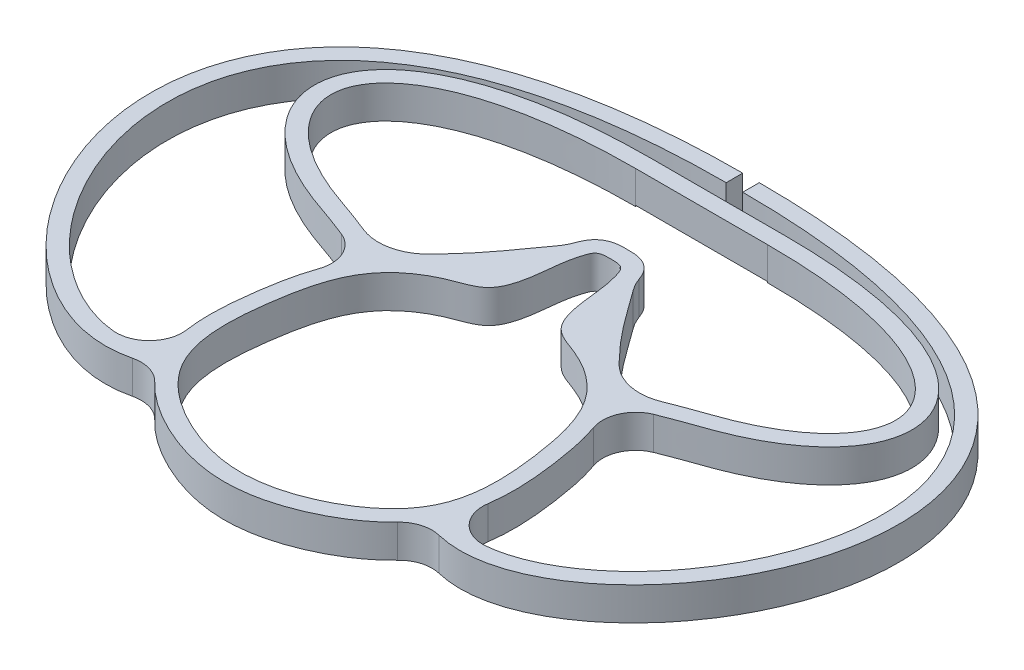
from build123d import *
from build123d.topology import SkipClean

# Parameters (mm, degrees)
BOSS_EXTRUDE1_DEPTH = 10
BOSS_EXTRUDE2_DEPTH = 10
BOSS_EXTRUDE3_REACH = 171.643
SKETCH5_W           = 5
SKETCH5_H           = 9.675639368
BOSS_EXTRUDE4_DEPTH = 10
CUT_EXTRUDE1_DEPTH  = 10
FILLET1_R           = 10
FILLET2_R           = 15
FILLET3_R           = 15


# Read off the part's stored shape, not the designer's step: Boss-Extrude1, Cut-Extrude1
with BuildPart() as part:
    # Boss-Extrude1 outline → Boss-Extrude1 (new body)
    with BuildSketch(Plane(origin=(0, 0, 0), x_dir=(1, 0, 0), z_dir=(0, 1, 0))):
        with BuildLine():
            add(Edge.make_bspline(
                [(0, 67), (-0.227277761, 67), (-0.681833283, 67.001666463), (-1.53188424, 66.987419462), (-2.512616186, 66.920390168), (-3.659808632, 66.741423554), (-4.988078912, 66.345813864), (-6.461410265, 65.591532761), (-7.855664764, 64.320134683), (-8.674867778, 63.107594724), (-9.208577304, 62.038948076), (-9.565323902, 61.116231979), (-9.81270012, 60.379002225), (-10.109494449, 59.430262188), (-10.431305892, 58.253962276), (-10.746251776, 56.878966311), (-11.001988254, 55.538552687), (-11.278954519, 53.801167078), (-11.533903834, 51.724013951), (-11.779395274, 49.374961626), (-12.037895469, 47.15146515), (-12.37325539, 45.013087546), (-12.836023726, 42.949483136), (-13.43538801, 41.198480929), (-14.003306657, 40.162683233), (-14.421319862, 39.640462503), (-14.785845689, 39.289383208), (-15.662463961, 38.701677793), (-17.417991117, 37.934908047), (-19.71677033, 37.105178592), (-22.397054658, 36.023724998), (-24.923710241, 34.773040568), (-27.361549766, 33.353237603), (-30.447251781, 31.236918919), (-33.968327967, 28.188031587), (-37.531580238, 23.840893393), (-40.196367538, 19.062950436), (-42.777966406, 12.392766722), (-44.256778564, 5.449271056), (-45.276374738, -1.416843531), (-45.88344846, -6.702537457), (-46.188923174, -12.061007753), (-46.075354509, -17.440185452), (-45.397688101, -22.789778918), (-44.007346965, -28.029159469), (-41.697102792, -33.095574637), (-38.474325789, -37.633129013), (-34.621503503, -41.580890086), (-28.836339185, -46.140112515), (-20.775488621, -50.574915101), (-10.663531249, -54.093742691), (1.1e-08, -55.453128652), (10.663531287, -54.093742702), (20.775488621, -50.574915094), (28.836339175, -46.140112511), (34.621503494, -41.580890085), (38.474325783, -37.633129015), (41.69710279, -33.09557464), (44.007346967, -28.029159472), (45.397688104, -22.78977892), (46.075354512, -17.440185452), (46.188923176, -12.061007753), (45.883448461, -6.702537456), (45.276374738, -1.416843531), (44.256778563, 5.449271057), (42.777966405, 12.392766722), (40.196367538, 19.062950436), (37.531580238, 23.840893392), (33.968327967, 28.188031587), (30.447251781, 31.236918919), (27.361549766, 33.353237603), (24.923710241, 34.773040568), (22.397054658, 36.023724998), (19.71677033, 37.105178592), (17.417991117, 37.934908047), (15.662463961, 38.701677793), (14.785845689, 39.289383208), (14.421319862, 39.640462503), (14.003306657, 40.162683233), (13.43538801, 41.198480929), (12.836023726, 42.949483136), (12.37325539, 45.013087546), (12.037895469, 47.15146515), (11.779395274, 49.374961626), (11.533903834, 51.724013951), (11.278954519, 53.801167078), (11.001988254, 55.538552687), (10.746251776, 56.878966311), (10.431305892, 58.253962276), (10.109494449, 59.430262188), (9.81270012, 60.379002225), (9.565323902, 61.116231979), (9.208577304, 62.038948076), (8.674867778, 63.107594724), (7.855664764, 64.320134683), (6.461410265, 65.591532761), (4.988078912, 66.345813864), (3.659808632, 66.741423554), (2.512616186, 66.920390168), (1.53188424, 66.987419462), (0.681833283, 67.001666463), (0.227277761, 67), (0, 67)],
                knots=[0, 0, 0, 0, 0.001953125, 0.00390625, 0.005859375, 0.0078125, 0.009765625, 0.01171875, 0.013671875, 0.015625, 0.017578125, 0.01953125, 0.021484375, 0.0234375, 0.02734375, 0.03125, 0.03515625, 0.0390625, 0.046875, 0.0546875, 0.0625, 0.0703125, 0.078125, 0.0859375, 0.09375, 0.09765625, 0.1015625, 0.109375, 0.1171875, 0.125, 0.1328125, 0.140625, 0.1484375, 0.15625, 0.171875, 0.1875, 0.203125, 0.21875, 0.25, 0.265625, 0.28125, 0.296875, 0.3125, 0.328125, 0.34375, 0.359375, 0.375, 0.390625, 0.40625, 0.4375, 0.46875, 0.5, 0.53125, 0.5625, 0.59375, 0.609375, 0.625, 0.640625, 0.65625, 0.671875, 0.6875, 0.703125, 0.71875, 0.734375, 0.75, 0.78125, 0.796875, 0.8125, 0.828125, 0.84375, 0.8515625, 0.859375, 0.8671875, 0.875, 0.8828125, 0.890625, 0.8984375, 0.90234375, 0.90625, 0.9140625, 0.921875, 0.9296875, 0.9375, 0.9453125, 0.953125, 0.9609375, 0.96484375, 0.96875, 0.97265625, 0.9765625, 0.978515625, 0.98046875, 0.982421875, 0.984375, 0.986328125, 0.98828125, 0.990234375, 0.9921875, 0.994140625, 0.99609375, 0.998046875, 1, 1, 1, 1], degree=3))
        make_face()
        with BuildLine():
            add(Edge.make_bspline(
                [(0, 62), (-1.449319465, 62), (-3.858982521, 62.04949065), (-6.738088954, 54.674450921), (-6.398410727, 46.424048099), (-10.00931101, 34.796181627), (-21.899395638, 31.626752299), (-35.797702461, 21.622188592), (-41.072037529, -2.03881706), (-42.664534833, -30.677270085), (-20.455240468, -46.503909991), (2.22e-07, -51.476412309), (20.455240774, -46.503909745), (42.664534842, -30.677270089), (41.072037527, -2.038817059), (35.797702462, 21.622188592), (21.899395638, 31.626752299), (10.00931101, 34.796181627), (6.398410727, 46.424048099), (6.738088954, 54.674450921), (3.858982521, 62.04949065), (1.449319465, 62), (0, 62)],
                knots=[0, 0, 0, 0, 0.01260166, 0.020951733, 0.070611873, 0.099127767, 0.128336455, 0.183200023, 0.259103987, 0.357412488, 0.439784745, 0.500000002, 0.560215255, 0.642587512, 0.740896013, 0.816799977, 0.871663545, 0.900872233, 0.929388127, 0.979048267, 0.98739834, 1, 1, 1, 1], degree=3))
        make_face(mode=Mode.SUBTRACT)
    extrude(amount=BOSS_EXTRUDE1_DEPTH)

    # Sketch4 → Boss-Extrude2 (add)
    with SkipClean():  # the faces are left unmerged after this step: merging them gives an invalid solid
        with BuildSketch(Plane(origin=(0, 0, 0), x_dir=(1, 0, 0), z_dir=(0, 1, 0))):
            with BuildLine():
                Line((36.001435144, 21.510151116), (32.989848884, 25.501435144))
                add(Edge.make_bspline(
                    [(32.989848884, 25.501435144), (33.872885271, 26.167722041), (35.70627525, 27.442947556), (39.412291226, 29.656207311), (44.146726789, 31.935811391), (49.778788636, 34.120248533), (55.204617591, 36.003618773), (60.222668304, 37.804441191), (66.261128759, 40.406907607), (72.735637535, 44.029228931), (78.689747015, 48.769362933), (82.814006884, 53.702907128), (85.126039639, 58.613963179), (85.736019918, 63.354621027), (84.727818137, 67.976997128), (81.951398145, 72.574921409), (77.174218712, 77.030053571), (70.266405808, 81.113970819), (62.685058655, 84.025405736), (55.50694373, 85.96352112), (49.562823706, 87.199703158), (43.053997804, 88.197120813), (37.156071694, 88.812170602), (32.150826498, 89.164473975), (28.253879576, 89.356359617), (24.883393499, 89.453928271), (22.120518947, 89.493360579), (20.703917009, 89.5), (20, 89.5)],
                    knots=[0, 0, 0, 0, 0.015625, 0.03125, 0.0625, 0.09375, 0.125, 0.15625, 0.1875, 0.25, 0.3125, 0.375, 0.4375, 0.5, 0.5625, 0.625, 0.6875, 0.75, 0.8125, 0.84375, 0.875, 0.90625, 0.9375, 0.953125, 0.96875, 0.984375, 0.9921875, 1, 1, 1, 1], degree=3))
                Line((20, 89.5), (20, 94.5))
                add(Edge.make_bspline(
                    [(36.001435144, 21.510151116), (36.787353247, 22.103158314), (38.41215106, 23.23341812), (41.75318908, 25.230241561), (46.109318801, 27.331559417), (51.473302563, 29.415314403), (56.822722549, 31.272745471), (62.033332845, 33.140687066), (68.490270454, 35.920857119), (75.481392114, 39.826546751), (82.146371183, 45.111108904), (87.014356274, 50.893766256), (89.978752698, 57.093818062), (90.840895008, 63.561777201), (89.428293025, 69.948343891), (85.802397561, 75.862447574), (80.107155766, 81.125203271), (72.383848138, 85.667804388), (64.233189607, 88.787969959), (56.657749977, 90.832221781), (50.441682078, 92.124204995), (43.684113773, 93.159188874), (37.595989232, 93.793709294), (32.447651138, 94.156026664), (28.44762402, 94.352944671), (24.994641313, 94.452873973), (22.167505261, 94.49321488), (20.719652627, 94.5), (20, 94.5)],
                    knots=[0, 0, 0, 0, 0.015625, 0.03125, 0.0625, 0.09375, 0.125, 0.15625, 0.1875, 0.25, 0.3125, 0.375, 0.4375, 0.5, 0.5625, 0.625, 0.6875, 0.75, 0.8125, 0.84375, 0.875, 0.90625, 0.9375, 0.953125, 0.96875, 0.984375, 0.9921875, 1, 1, 1, 1], degree=3))
            make_face()
            with BuildLine():
                Line((38.495197904, -33.392577358), (40.892577358, -29.004802096))
                add(Edge.make_bspline(
                    [(40.892577358, -29.004802096), (41.312625944, -29.234306979), (42.171418914, -29.676482267), (43.871583625, -30.44643491), (46.006564059, -31.223557149), (48.572376388, -31.870163588), (52.00609967, -32.374234855), (56.325810275, -32.365824), (63.290306726, -31.105045204), (72.031798663, -27.396461734), (82.047486904, -20.227411651), (91.092686595, -10.784912996), (101.249050978, 4.150738003), (107.653654804, 21.566800636), (108.674992071, 39.368395292), (106.385287015, 52.420187702), (100.663597402, 64.743387458), (91.059797932, 75.959707892), (79.376006686, 84.026780706), (67.560232156, 89.451479145), (57.405420795, 92.935683077), (45.901005212, 95.766311436), (35.144967454, 97.523129539), (25.811490261, 98.53351264), (18.443264592, 99.085415563), (11.981918075, 99.366847206), (6.637273541, 99.480783681), (3.871322005, 99.5), (2.5, 99.5)],
                    knots=[0, 0, 0, 0, 0.0078125, 0.015625, 0.03125, 0.046875, 0.0625, 0.09375, 0.125, 0.1875, 0.25, 0.3125, 0.375, 0.5, 0.5625, 0.625, 0.6875, 0.75, 0.8125, 0.84375, 0.875, 0.90625, 0.9375, 0.953125, 0.96875, 0.984375, 0.9921875, 1, 1, 1, 1], degree=3))
                Line((2.5, 99.5), (2.5, 104.5))
                add(Edge.make_bspline(
                    [(38.495197904, -33.392577358), (39.471102148, -33.925788985), (41.500454382, -34.908052967), (45.54068833, -36.376711874), (50.670587157, -37.387395456), (56.804554997, -37.369693743), (64.860578956, -35.90052944), (74.550088098, -31.759525099), (85.367866601, -24.00301227), (95.006555979, -13.93295894), (105.769235978, 1.90059939), (112.593486204, 20.391533192), (113.713645947, 39.629040323), (111.216311536, 53.922160445), (104.908413403, 67.508513796), (94.390659832, 79.765569826), (81.855360127, 88.3954538), (69.400451497, 94.109385512), (58.798441758, 97.744580834), (46.885756887, 100.673672873), (35.823086814, 102.479301422), (26.26376995, 103.513930665), (18.735479033, 104.077676316), (12.148369673, 104.364494424), (6.707040718, 104.480464214), (3.894744794, 104.5), (2.5, 104.5)],
                    knots=[0, 0, 0, 0, 0.015625, 0.03125, 0.0625, 0.09375, 0.125, 0.1875, 0.25, 0.3125, 0.375, 0.5, 0.5625, 0.625, 0.6875, 0.75, 0.8125, 0.84375, 0.875, 0.90625, 0.9375, 0.953125, 0.96875, 0.984375, 0.9921875, 1, 1, 1, 1], degree=3))
            make_face()
        boss_extrude2 = extrude(amount=BOSS_EXTRUDE2_DEPTH)
    add(part.part.scale(1), mode=Mode.REPLACE)  # the faces are merged on a copy

    # Mirror1: Boss-Extrude2 across plane
    add(boss_extrude2.mirror(Plane(origin=(0, 0, 0), x_dir=(0, 0, 1), z_dir=(1, 0, 0))))

    # Sketch5 → Boss-Extrude3 (add, up to next)
    with BuildSketch(Plane(origin=(-20, 0, 0), x_dir=(0, 0, -1), z_dir=(1, 0, 0)), mode=Mode.PRIVATE) as boss_extrude3_sk1:
        with Locations((92, 5.162180316)):
            Rectangle(SKETCH5_W, SKETCH5_H)
    boss_extrude3_tool1 = extrude(boss_extrude3_sk1.sketch, amount=BOSS_EXTRUDE3_REACH, mode=Mode.PRIVATE) - part.part
    add(boss_extrude3_tool1.solids().sort_by_distance((-20, 5.16218, -92))[0])

    # Sketch6 → Boss-Extrude4 (add)
    with BuildSketch(Plane(origin=(0, 0, 0), x_dir=(1, 0, 0), z_dir=(0, 1, 0))):
        with BuildLine():
            add(Edge.make_bspline(
                [(-37.957326404, 22.894906265), (-37.802151607, 27.738814294), (-18.480344627, 43.094639893), (0, 80.957197177), (18.480344627, 43.094639893), (62.988987422, 7.721811817), (-38.443397122, 7.721811817), (-37.957326404, 22.894906265)],
                knots=[0, 0, 0, 0, 0.125970088, 0.302705167, 0.479440246, 0.605410335, 1, 1, 1, 1], degree=3))
        make_face()
    extrude(amount=BOSS_EXTRUDE4_DEPTH)

    # Cut-Extrude1 outline → Cut-Extrude1 (cut)
    with BuildSketch(Plane(origin=(0, 0, 0), x_dir=(1, 0, 0), z_dir=(0, 1, 0))):
        with BuildLine():
            add(Edge.make_bspline(
                [(34.986518133, 18.037038263), (34.264490133, 19.425724526), (30.565762426, 25.388350762), (21.899395638, 31.626752299), (10.00931101, 34.796181627), (6.398410727, 46.424048099), (6.738088954, 54.674450921), (3.858982521, 62.04949065), (0, 61.970233282), (-3.858982521, 62.04949065), (-6.738088954, 54.674450921), (-6.398410727, 46.424048099), (-10.00931101, 34.796181627), (-21.899395638, 31.626752299), (-30.565762426, 25.388350763), (-34.264490133, 19.425724526), (-34.986518133, 18.037038264)],
                knots=[0.801118169, 0.801118169, 0.801118169, 0.801118169, 0.816799977, 0.871663545, 0.900872233, 0.929388127, 0.979048267, 0.98739834, 1, 1.01260166, 1.020951733, 1.070611873, 1.099127767, 1.128336455, 1.183200023, 1.198881831, 1.198881831, 1.198881831, 1.198881831], degree=3))
            add(Edge.make_bspline(
                [(-34.986518133, 18.037038264), (-22.852190251, 9.341101151), (22.85219025, 9.34110115), (34.986518133, 18.037038263)],
                knots=[0.047933966, 0.047933966, 0.047933966, 0.047933966, 0.346655699, 0.346655699, 0.346655699, 0.346655699], degree=3))
        make_face()
    extrude(amount=CUT_EXTRUDE1_DEPTH, mode=Mode.SUBTRACT)

    # Fillet1
    fillet1_edges = [part.edges().sort_by_distance(p)[0] for p in [
        (-37.957326404, 5, -22.894906265),
        (-43.032411334, 5, 30.062050404),
        (-40.645121007, 5, 34.470072732),
        (40.645121006, 5, 34.470072731),
        (43.032411335, 5, 30.062050404),
        (37.957326404, 5, -22.894906265),
    ]]
    fillet(fillet1_edges, radius=FILLET1_R)

    # Fillet2
    fillet2_edges = [part.edges().sort_by_distance(p)[0] for p in [
        (-35.997404228, 5, -27.584287941),
        (35.997404228, 5, -27.584287941),
    ]]
    fillet(fillet2_edges, radius=FILLET2_R)

    # Fillet3
    fillet3_edges = [part.edges().sort_by_distance(p)[0] for p in [
        (10.199818113, 5, -59.088208175),
        (-10.199818113, 5, -59.088208175),
    ]]
    fillet(fillet3_edges, radius=FILLET3_R)


solid = part.part
